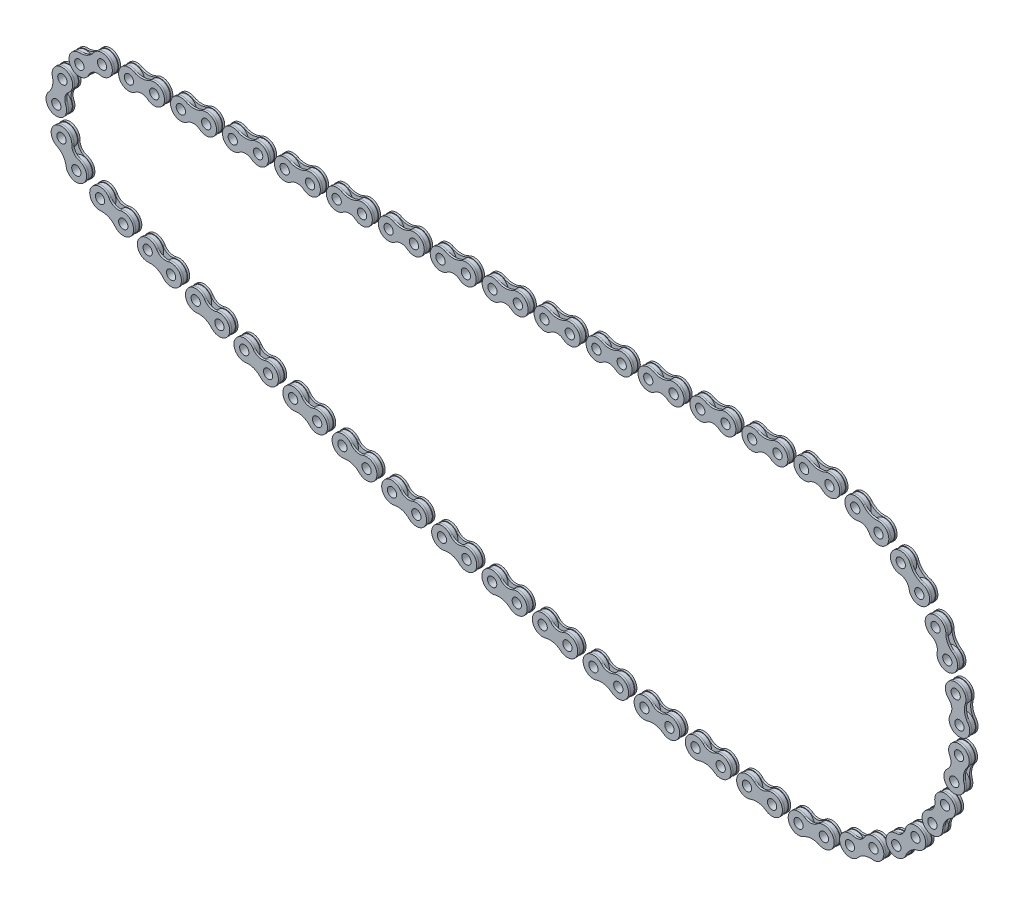
from build123d import *

# Parameters (mm, degrees)
SZKIC1_R                      = 4.75
SZKIC1_R_2                    = 2.25
DODANIE_WYCI_GNI_CIE1_DEPTH   = 1
DODANIE_WYCI_GNI_CIE1_2_DEPTH = 1
SZKIC2_R                      = 2.25
DODANIE_WYCI_GNI_CIE2_DEPTH   = 1
CRVPATTERN1_5_ANGLE           = 4.4891132
CRVPATTERN1_6_ANGLE           = 23.7215852
CRVPATTERN1_7_ANGLE           = 42.9540573
CRVPATTERN1_8_ANGLE           = 62.1865294
CRVPATTERN1_9_ANGLE           = 81.4190015
CRVPATTERN1_10_ANGLE          = 100.6514735
CRVPATTERN1_11_ANGLE          = 119.8839456
CRVPATTERN1_12_ANGLE          = 139.1164177
CRVPATTERN1_13_ANGLE          = 158.3488898
CRVPATTERN1_14_ANGLE          = 177.5813619
CRVPATTERN1_15_ANGLE          = 172.4375527
CRVPATTERN1_16_ANGLE          = 171.1891449
CRVPATTERN1_17_ANGLE          = 169.940737
CRVPATTERN1_18_ANGLE          = 168.6923292
CRVPATTERN1_19_ANGLE          = 167.4439213
CRVPATTERN1_20_ANGLE          = 166.1955135
CRVPATTERN1_21_ANGLE          = 164.9471056
CRVPATTERN1_22_ANGLE          = 163.6986977
CRVPATTERN1_23_ANGLE          = 162.4502899
CRVPATTERN1_24_ANGLE          = 161.201882
CRVPATTERN1_25_ANGLE          = 159.9534742
CRVPATTERN1_26_ANGLE          = 158.7050663
CRVPATTERN1_27_ANGLE          = 157.4566585
CRVPATTERN1_28_ANGLE          = 156.2082506
CRVPATTERN1_29_ANGLE          = 125.7508825
CRVPATTERN1_30_ANGLE          = 76.1826555
CRVPATTERN1_31_ANGLE          = 26.6144285


with BuildPart() as part:
    # Szkic1 → Dodanie-wyciągnięcie1 (new, symmetric)
    with BuildSketch(Plane.XY):
        with Locations((-6.15, 0)):
            Circle(SZKIC1_R)
        with Locations((-6.15, 0)):
            Circle(SZKIC1_R_2, mode=Mode.SUBTRACT)
    extrude(amount=DODANIE_WYCI_GNI_CIE1_DEPTH, both=True)



with BuildPart() as body_2:
    # Szkic1 → Dodanie-wyci_gni_cie1 2 (new, symmetric)
    with BuildSketch(Plane.XY):
        with Locations(Location((6.15, 0, 0), (0, 0, 180))):
            Circle(SZKIC1_R)
        with Locations((6.15, 0)):
            Circle(SZKIC1_R_2, mode=Mode.SUBTRACT)
    extrude(amount=DODANIE_WYCI_GNI_CIE1_2_DEPTH, both=True)


with BuildPart() as part_1:
    add(part.part)

    add(body_2.part)  # Dodanie-wyciągnięcie2 merges body 2
    # Szkic2 → Dodanie-wyciągnięcie2 (add)
    with BuildSketch(Plane.XY.offset(1)):
        with BuildLine():
            ThreePointArc((-3.80333604, 4.415106823), (-11.129358222, -0.453863083), (-3.043774955, -3.918081925))
            ThreePointArc((-3.043774955, -3.918081925), (0, -2.857915616), (3.043774955, -3.918081925))
            ThreePointArc((3.043774955, -3.918081925), (11.129358222, -0.453863083), (3.80333604, 4.415106823))
            ThreePointArc((3.80333604, 4.415106823), (0, 3.467146085), (-3.80333604, 4.415106823))
        make_face()
        with Locations((-6.15, 0)):
            Circle(SZKIC2_R, mode=Mode.SUBTRACT)
        with Locations((6.15, 0)):
            Circle(SZKIC2_R, mode=Mode.SUBTRACT)
    dodanie_wyci_gni_cie2 = extrude(amount=DODANIE_WYCI_GNI_CIE2_DEPTH)

    # Lustro1: Dodanie-wyciągnięcie2 across plane
    add(dodanie_wyci_gni_cie2.mirror(Plane.XY))


with BuildPart() as body_2_2:
    # CrvPattern1: read off the stored shape, not the designer's step
    # CrvPattern1: copy of part
    add(part_1.part.moved(Location((25.1752471, 0, 0))))


with BuildPart() as body_3:
    # CrvPattern1 2: copy of part
    add(part_1.part.moved(Location((50.3504942, 0, 0))))


with BuildPart() as body_4:
    # CrvPattern1 3: copy of part
    add(part_1.part.moved(Location((75.5257412, 0, 0))))


with BuildPart() as body_5:
    # CrvPattern1 4: copy of part
    add(part_1.part.moved(Location((100.7009883, 0, 0))))


with BuildPart() as body_6:
    # CrvPattern1 5: copy of part
    add(part_1.part.moved(Location((125.4974938, 9.6222633, 0))).rotate(Axis((0, 0, 0), (0, 0, -1)), CRVPATTERN1_5_ANGLE))


with BuildPart() as body_7:
    # CrvPattern1 6: copy of part
    add(part_1.part.moved(Location((140.0096511, 54.6068289, 0))).rotate(Axis((0, 0, 0), (0, 0, -1)), CRVPATTERN1_6_ANGLE))


with BuildPart() as body_8:
    # CrvPattern1 7: copy of part
    add(part_1.part.moved(Location((138.893885, 101.8611294, 0))).rotate(Axis((0, 0, 0), (0, 0, -1)), CRVPATTERN1_7_ANGLE))


with BuildPart() as body_9:
    # CrvPattern1 8: copy of part
    add(part_1.part.moved(Location((122.2747376, 146.1106242, 0))).rotate(Axis((0, 0, 0), (0, 0, -1)), CRVPATTERN1_8_ANGLE))


with BuildPart() as body_10:
    # CrvPattern1 9: copy of part
    add(part_1.part.moved(Location((92.0072438, 182.4161702, 0))).rotate(Axis((0, 0, 0), (0, 0, -1)), CRVPATTERN1_9_ANGLE))


with BuildPart() as body_11:
    # CrvPattern1 10: copy of part
    add(part_1.part.moved(Location((51.469871, 206.7253303, 0))).rotate(Axis((0, 0, 0), (0, 0, -1)), CRVPATTERN1_10_ANGLE))


with BuildPart() as body_12:
    # CrvPattern1 11: copy of part
    add(part_1.part.moved(Location((5.1874143, 216.324708, 0))).rotate(Axis((0, 0, 0), (0, 0, -1)), CRVPATTERN1_11_ANGLE))


with BuildPart() as body_13:
    # CrvPattern1 12: copy of part
    add(part_1.part.moved(Location((-41.6740633, 210.1428176, 0))).rotate(Axis((0, 0, 0), (0, 0, -1)), CRVPATTERN1_12_ANGLE))


with BuildPart() as body_14:
    # CrvPattern1 13: copy of part
    add(part_1.part.moved(Location((-83.8838682, 188.8696839, 0))).rotate(Axis((0, 0, 0), (0, 0, -1)), CRVPATTERN1_13_ANGLE))


with BuildPart() as body_15:
    # CrvPattern1 14: copy of part
    add(part_1.part.moved(Location((-116.7305281, 154.8798209, 0))).rotate(Axis((0, 0, 0), (0, 0, -1)), CRVPATTERN1_14_ANGLE))


with BuildPart() as body_16:
    # CrvPattern1 15: copy of part
    add(part_1.part.moved(Location((-116.7092288, 133.5057279, 0))).rotate(Axis((0, 0, 0), (0, 0, 1)), CRVPATTERN1_15_ANGLE))


with BuildPart() as body_17:
    # CrvPattern1 16: copy of part
    add(part_1.part.moved(Location((-94.4182538, 131.2055267, 0))).rotate(Axis((0, 0, 0), (0, 0, 1)), CRVPATTERN1_16_ANGLE))


with BuildPart() as body_18:
    # CrvPattern1 17: copy of part
    add(part_1.part.moved(Location((-72.0824553, 129.3915273, 0))).rotate(Axis((0, 0, 0), (0, 0, 1)), CRVPATTERN1_17_ANGLE))


with BuildPart() as body_19:
    # CrvPattern1 18: copy of part
    add(part_1.part.moved(Location((-49.7124367, 128.0645909, 0))).rotate(Axis((0, 0, 0), (0, 0, 1)), CRVPATTERN1_18_ANGLE))


with BuildPart() as body_20:
    # CrvPattern1 19: copy of part
    add(part_1.part.moved(Location((-27.318818, 127.2253473, 0))).rotate(Axis((0, 0, 0), (0, 0, 1)), CRVPATTERN1_19_ANGLE))


with BuildPart() as body_21:
    # CrvPattern1 20: copy of part
    add(part_1.part.moved(Location((-4.91223, 126.8741951, 0))).rotate(Axis((0, 0, 0), (0, 0, 1)), CRVPATTERN1_20_ANGLE))


with BuildPart() as body_22:
    # CrvPattern1 21: copy of part
    add(part_1.part.moved(Location((17.4966899, 127.0113008, 0))).rotate(Axis((0, 0, 0), (0, 0, 1)), CRVPATTERN1_21_ANGLE))


with BuildPart() as body_23:
    # CrvPattern1 22: copy of part
    add(part_1.part.moved(Location((39.8973036, 127.6365995, 0))).rotate(Axis((0, 0, 0), (0, 0, 1)), CRVPATTERN1_22_ANGLE))


with BuildPart() as body_24:
    # CrvPattern1 23: copy of part
    add(part_1.part.moved(Location((62.2789766, 128.7497942, 0))).rotate(Axis((0, 0, 0), (0, 0, 1)), CRVPATTERN1_23_ANGLE))


with BuildPart() as body_25:
    # CrvPattern1 24: copy of part
    add(part_1.part.moved(Location((84.6310837, 130.3503565, 0))).rotate(Axis((0, 0, 0), (0, 0, 1)), CRVPATTERN1_24_ANGLE))


with BuildPart() as body_26:
    # CrvPattern1 25: copy of part
    add(part_1.part.moved(Location((106.9430135, 132.4375265, 0))).rotate(Axis((0, 0, 0), (0, 0, 1)), CRVPATTERN1_25_ANGLE))


with BuildPart() as body_27:
    # CrvPattern1 26: copy of part
    add(part_1.part.moved(Location((129.2041738, 135.0103135, 0))).rotate(Axis((0, 0, 0), (0, 0, 1)), CRVPATTERN1_26_ANGLE))


with BuildPart() as body_28:
    # CrvPattern1 27: copy of part
    add(part_1.part.moved(Location((151.4039965, 138.0674959, 0))).rotate(Axis((0, 0, 0), (0, 0, 1)), CRVPATTERN1_27_ANGLE))


with BuildPart() as body_29:
    # CrvPattern1 28: copy of part
    add(part_1.part.moved(Location((173.5319425, 141.6076226, 0))).rotate(Axis((0, 0, 0), (0, 0, 1)), CRVPATTERN1_28_ANGLE))


with BuildPart() as body_30:
    # CrvPattern1 29: copy of part
    add(part_1.part.moved(Location((100.9140345, 218.9209908, 0))).rotate(Axis((0, 0, 0), (0, 0, 1)), CRVPATTERN1_29_ANGLE))


with BuildPart() as body_31:
    # CrvPattern1 30: copy of part
    add(part_1.part.moved(Location((-79.0854279, 228.9998793, 0))).rotate(Axis((0, 0, 0), (0, 0, 1)), CRVPATTERN1_30_ANGLE))


with BuildPart() as body_32:
    # CrvPattern1 31: copy of part
    add(part_1.part.moved(Location((-203.4944946, 98.5246918, 0))).rotate(Axis((0, 0, 0), (0, 0, 1)), CRVPATTERN1_31_ANGLE))


with BuildPart() as body_33:
    # CrvPattern1 32: copy of part
    add(part_1.part.moved(Location((-201.4019766, 0, 0))))


with BuildPart() as body_34:
    # CrvPattern1 33: copy of part
    add(part_1.part.moved(Location((-176.2267295, 0, 0))))


with BuildPart() as body_35:
    # CrvPattern1 34: copy of part
    add(part_1.part.moved(Location((-151.0514825, 0, 0))))


with BuildPart() as body_36:
    # CrvPattern1 35: copy of part
    add(part_1.part.moved(Location((-125.8762354, 0, 0))))


with BuildPart() as body_37:
    # CrvPattern1 36: copy of part
    add(part_1.part.moved(Location((-100.7009883, 0, 0))))


with BuildPart() as body_38:
    # CrvPattern1 37: copy of part
    add(part_1.part.moved(Location((-75.5257412, 0, 0))))


with BuildPart() as body_39:
    # CrvPattern1 38: copy of part
    add(part_1.part.moved(Location((-50.3504942, 0, 0))))


with BuildPart() as body_40:
    # CrvPattern1 39: copy of part
    add(part_1.part.moved(Location((-25.1752471, 0, 0))))


solid = Compound([part_1.part, body_2_2.part, body_3.part, body_4.part, body_5.part, body_6.part, body_7.part, body_8.part, body_9.part, body_10.part, body_11.part, body_12.part, body_13.part, body_14.part, body_15.part, body_16.part, body_17.part, body_18.part, body_19.part, body_20.part, body_21.part, body_22.part, body_23.part, body_24.part, body_25.part, body_26.part, body_27.part, body_28.part, body_29.part, body_30.part, body_31.part, body_32.part, body_33.part, body_34.part, body_35.part, body_36.part, body_37.part, body_38.part, body_39.part, body_40.part])
